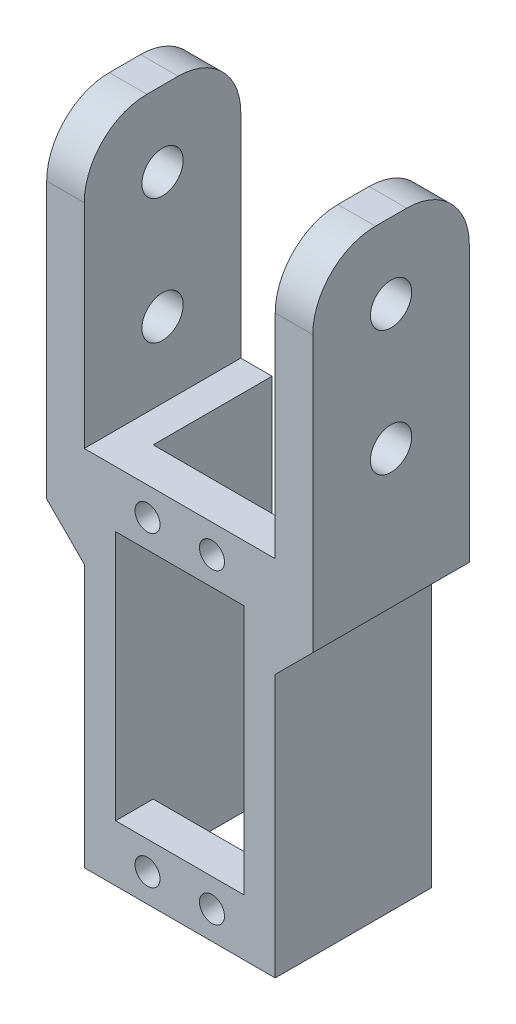
from build123d import *

# Parameters (mm, degrees)
SKETCH1_W            = 20.5
SKETCH1_H            = 9
BOSS_EXTRUDE1_DEPTH  = 6
SKETCH2_W            = 25
SKETCH2_H            = 58
BOSS_EXTRUDE2_DEPTH  = 5
LPATTERN1_COUNT      = 2
LPATTERN1_PITCH      = 49
LPATTERN2_COUNT      = 2
LPATTERN2_PITCH      = 25.5
CUT_EXTRUDE1_REACH   = 62.632
SKETCH3_R            = 2
LPATTERN3_COUNT      = 2
LPATTERN3_PITCH      = 10.3
LPATTERN3_COUNT_DIR2 = 2
LPATTERN3_PITCH_DIR2 = 49
SKETCH8_W            = 25
SKETCH8_H            = 50
BOSS_EXTRUDE3_DEPTH  = 6
LPATTERN4_COUNT      = 2
LPATTERN4_PITCH      = 36.5
M6_CLEARANCE_HOLE1_D = 6.6
CHAMFER2_SIZE        = 10
LPATTERN5_COUNT      = 2
LPATTERN5_PITCH      = 20
FILLET1_R            = 10


with BuildPart() as part:
    # Sketch1 → Boss-Extrude1 (new body)
    with BuildSketch(Plane.XY):
        with Locations((10.25, 4.5)):
            Rectangle(SKETCH1_W, SKETCH1_H)
    boss_extrude1 = extrude(amount=BOSS_EXTRUDE1_DEPTH)

    # Sketch2 → Boss-Extrude2 (add)
    with BuildSketch(Plane(origin=(20.5, 0, 0), x_dir=(0, 0, -1), z_dir=(1, 0, 0))):
        with Locations((6.5, -20)):
            Rectangle(SKETCH2_W, SKETCH2_H)
    boss_extrude2 = extrude(amount=BOSS_EXTRUDE2_DEPTH)

    # LPattern1: Boss-Extrude1 ×2
    with Locations(*[(0, -i * LPATTERN1_PITCH, 0) for i in range(1, LPATTERN1_COUNT)]):
        add(boss_extrude1)

    # LPattern2: Boss-Extrude2 ×2
    with Locations(*[(-i * LPATTERN2_PITCH, 0, 0) for i in range(1, LPATTERN2_COUNT)]):
        add(boss_extrude2)

    # Sketch3 → Cut-Extrude1 (cut, up to next)
    with BuildSketch(Plane.XY.offset(6), mode=Mode.PRIVATE) as cut_extrude1_sk1:
        with Locations((5.1, 4.5)):
            Circle(SKETCH3_R)
    cut_extrude1_tool1 = extrude(cut_extrude1_sk1.sketch, amount=-CUT_EXTRUDE1_REACH, mode=Mode.PRIVATE) & part.part
    cut_extrude1 = cut_extrude1_tool1.solids().sort_by_distance((5.1, 4.5, 6))[0]
    add(cut_extrude1, mode=Mode.SUBTRACT)

    # LPattern3: Cut-Extrude1 2 × 2
    with Locations(*[(i * LPATTERN3_PITCH, -j * LPATTERN3_PITCH_DIR2, 0) for i in range(LPATTERN3_COUNT) for j in range(LPATTERN3_COUNT_DIR2) if (i, j) != (0, 0)]):
        add(cut_extrude1, mode=Mode.SUBTRACT)

    # Sketch8 → Boss-Extrude3 (add)
    with BuildSketch(Plane(origin=(25.5, 0, 0), x_dir=(0, 0, -1), z_dir=(1, 0, 0))):
        with Locations((6.5, 27.997404855)):
            Rectangle(SKETCH8_W, SKETCH8_H)
    boss_extrude3 = extrude(amount=BOSS_EXTRUDE3_DEPTH)

    # LPattern4: Boss-Extrude3 ×2
    with Locations(*[(-i * LPATTERN4_PITCH, 0, 0) for i in range(1, LPATTERN4_COUNT)]):
        add(boss_extrude3)

    # M6 Clearance Hole1 (through all)
    with Locations(Plane.ZY.offset(11)):
        with Locations((-6.5, 21)):
            m6_clearance_hole1 = Hole(M6_CLEARANCE_HOLE1_D / 2)

    # Chamfer2
    # the kernel refuses this chamfer: 10 mm, written as the material it adds along each edge
    with BuildSketch(Plane(origin=(-5, 2.997404855, 6), x_dir=(-0.9996219169112968, 0.027495876610586403, 0), z_dir=(0, 0, -1))) as chamfer2_piece_1_section:
        Polygon((CHAMFER2_SIZE * 0.999621916911, -CHAMFER2_SIZE * 0.0274958766106), (-CHAMFER2_SIZE * 0.0274958766106, -CHAMFER2_SIZE * 0.999621916911), (0, 0), align=None)
    chamfer2_piece_1 = extrude(amount=25, mode=Mode.PRIVATE)
    chamfer2_piece_1 = split(chamfer2_piece_1, bisect_by=Plane(origin=(-11, -0.75268974, -6.5), z_dir=(1, 0, 0)), keep=Keep.TOP, mode=Mode.PRIVATE)
    add(chamfer2_piece_1)
    with BuildSketch(Plane(origin=(25.5, 2.997404855, 6), x_dir=(-0.02749587661058666, -0.9996219169112968, 0), z_dir=(0, 0, -1))) as chamfer2_piece_2_section:
        Polygon((CHAMFER2_SIZE * 0.999621916911, -CHAMFER2_SIZE * 0.0274958766106), (-CHAMFER2_SIZE * 0.0274958766106, -CHAMFER2_SIZE * 0.999621916911), (0, 0), align=None)
    chamfer2_piece_2 = extrude(amount=25, mode=Mode.PRIVATE)
    chamfer2_piece_2 = split(chamfer2_piece_2, bisect_by=Plane(origin=(31.5, -0.75268974, -6.5), z_dir=(-1, 0, 0)), keep=Keep.TOP, mode=Mode.PRIVATE)
    add(chamfer2_piece_2)

    # LPattern5: M6 Clearance Hole1 ×2
    with Locations(*[(0, i * LPATTERN5_PITCH, 0) for i in range(1, LPATTERN5_COUNT)]):
        add(m6_clearance_hole1, mode=Mode.SUBTRACT)

    # Fillet1
    fillet1_edges = [part.edges().sort_by_distance(p)[0] for p in [
        (28.5, 52.997404855, 6),
        (28.5, 52.997404855, -19),
        (-8, 52.997404855, 6),
        (-8, 52.997404855, -19),
    ]]
    fillet(fillet1_edges, radius=FILLET1_R)


solid = part.part
